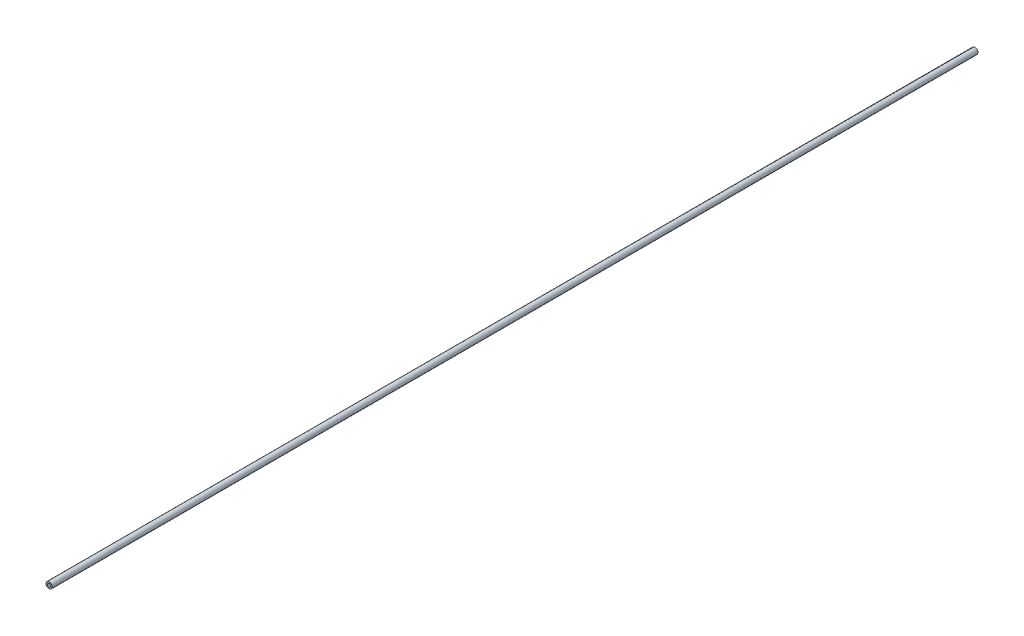
from build123d import *

# Parameters (mm, degrees)
SKETCH1_R           = 12.7
SKETCH1_R_2         = 6.35
BOSS_EXTRUDE4_DEPTH = 3850.254127512


with BuildPart() as part:
    # Sketch1 → Boss-Extrude4 (new body)
    with BuildSketch(Plane.XY):
        Circle(SKETCH1_R)
        Circle(SKETCH1_R_2, mode=Mode.SUBTRACT)
    extrude(amount=BOSS_EXTRUDE4_DEPTH)


solid = part.part
